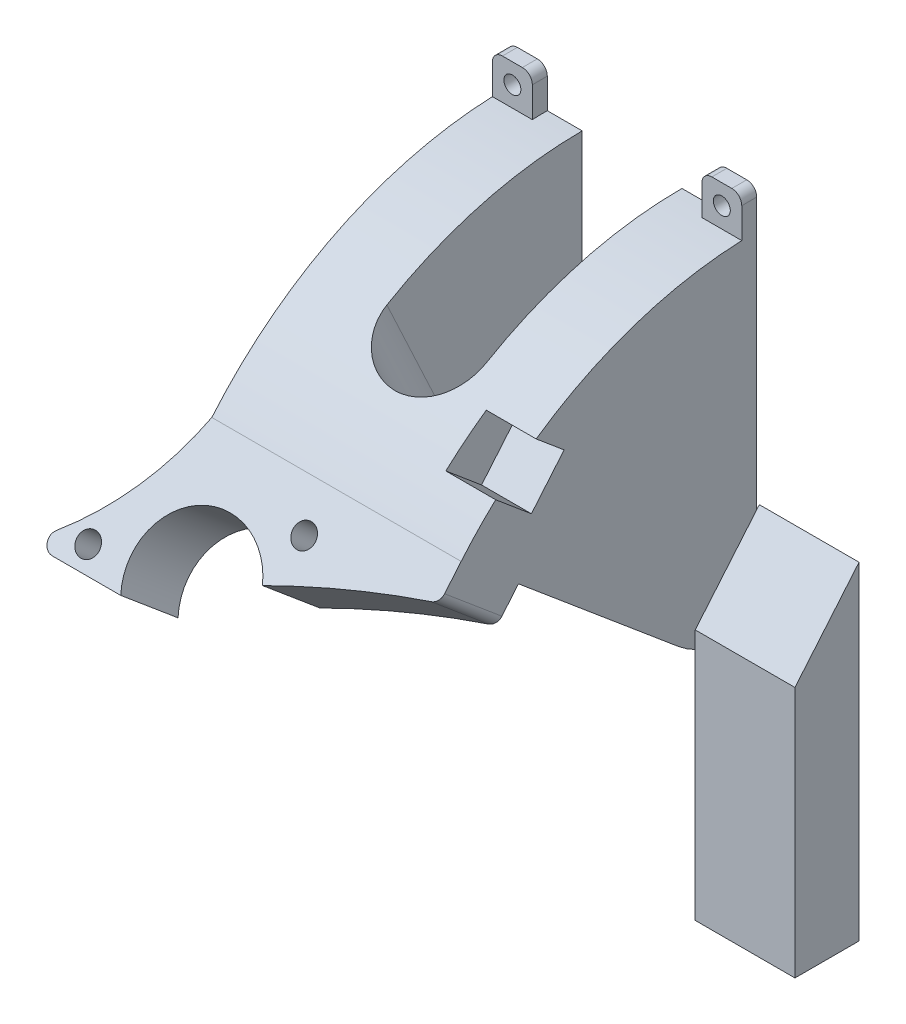
from build123d import *

# Parameters (mm, degrees)
AUFSATZ_LINEAR_AUSTRAGEN1_DEPTH    = 20
AUFSATZ_LINEAR_AUSTRAGEN2_DEPTH    = 20
AUFSATZ_LINEAR_AUSTRAGEN2_2_DEPTH  = 20
AUFSATZ_LINEAR_AUSTRAGEN3_DEPTH    = 50
AUFSATZ_LINEAR_AUSTRAGEN4_DEPTH    = 20
SCHNITT_LINEAR_AUSTRAGEN1_DEPTH    = 154.923378277
AUFSATZ_LINEAR_AUSTRAGEN5_DEPTH    = 50
VERRUNDUNG3_R                      = 2
SCHNITT_LINEAR_AUSTRAGEN3_DEPTH    = 5
SKIZZE12_W                         = 20
SKIZZE12_H                         = 50
SCHNITT_LINEAR_AUSTRAGEN4_DEPTH    = 163.425006425
VERRUNDUNG5_R                      = 10
VERRUNDUNG6_R                      = 10
SKIZZE13_R                         = 1.7
AUFSATZ_LINEAR_AUSTRAGEN9_DEPTH    = 3
VERRUNDUNG7_R                      = 2
VERRUNDUNG8_R                      = 2
SKIZZE14_W                         = 15
SKIZZE14_H                         = 9
SCHNITT_LINEAR_AUSTRAGEN5_DEPTH    = 156.193041065
VERRUNDUNG9_R                      = 18
SKIZZE15_R                         = 1.7
SCHNITT_LINEAR_AUSTRAGEN6_DEPTH    = 156.193041065
VERRUNDUNG10_R                     = 2
SKIZZE10_R                         = 2.25
SCHNITT_LINEAR_AUSTRAGEN2_DEPTH    = 152.160730356
SKIZZE18_W                         = 120
SKIZZE18_H                         = 10.2
SCHNITT_LINEAR_AUSTRAGEN8_DEPTH    = 10
VERRUNDUNG12_R                     = 18
VERRUNDUNG13_R                     = 2
SKIZZE16_R                         = 102.012355423
SCHNITT_LINEAR_AUSTRAGEN9_DEPTH    = 189.028945254
K_RPER_VERSCHIEBEN_KOPIEREN1_ANGLE = 90


with BuildPart() as part:
    # Skizze1 → Aufsatz-Linear austragen1 (new body)
    with BuildSketch(Plane(origin=(0, 0, 0), x_dir=(0, 0, -1), z_dir=(1, 0, 0))):
        Polygon((0, 0), (0, 65.780444431), (-12.855752194, 50.459555569), (-12.855752194, 0), align=None)
    extrude(amount=AUFSATZ_LINEAR_AUSTRAGEN1_DEPTH)


with BuildPart() as body_2:
    # Skizze2 → Aufsatz-Linear austragen2 (new body)
    with BuildSketch(Plane(origin=(0, 38.601549366, -32.390545836), x_dir=(-1, 0, 0), z_dir=(0, 0.7660444431189743, -0.6427876096865437))):
        with BuildLine():
            Line((90, 60.580920128), (90, 32.15785464))
            Line((90, 32.15785464), (40, 32.15785464))
            Line((40, 32.15785464), (40, 38.850263138))
            ThreePointArc((40, 38.850263138), (65.782949027, 47.91410669), (90, 60.580920128))
        make_face()
    extrude(amount=-AUFSATZ_LINEAR_AUSTRAGEN2_DEPTH)

    # Skizze4 → Aufsatz-Linear austragen3 (add)
    with BuildSketch(Plane.ZY.offset(90)):
        with BuildLine():
            ThreePointArc((-7.756199987, 59.272219883), (-28.145912406, 32.699829313), (-35.395290034, 0))
            Line((-35.395290034, 0), (41.979097856, 0))
            Line((41.979097856, 0), (5.099552207, 43.951331021))
            Line((5.099552207, 43.951331021), (-7.756199987, 59.272219883))
        make_face()
    extrude(amount=-AUFSATZ_LINEAR_AUSTRAGEN3_DEPTH)



with BuildPart() as body_3:
    # Skizze2 → Aufsatz-Linear austragen2 2 (new body)
    with BuildSketch(Plane(origin=(0, 38.601549366, -32.390545836), x_dir=(-1, 0, 0), z_dir=(0, 0.7660444431189743, -0.6427876096865437))):
        with BuildLine():
            Line((-110, 60.580920128), (-110, 32.15785464))
            Line((-110, 32.15785464), (-60, 32.15785464))
            Line((-60, 32.15785464), (-60, 38.850263138))
            ThreePointArc((-60, 38.850263138), (-85.782949027, 47.91410669), (-110, 60.580920128))
        make_face()
    extrude(amount=-AUFSATZ_LINEAR_AUSTRAGEN2_2_DEPTH)


with BuildPart() as body_2_1:
    add(body_2.part)

    add(body_3.part)  # Aufsatz-Linear austragen4 merges body 3
    # Skizze6 → Aufsatz-Linear austragen4 (add)
    with BuildSketch(Plane(origin=(0, 38.601549366, -32.390545836), x_dir=(1, 0, 0), z_dir=(0, 0.7660444431189745, -0.6427876096865438))):
        with BuildLine():
            ThreePointArc((-90, -32.15785464), (-97.308492273, -47.841026987), (-109.016228044, -60.580920128))
            Line((-109.016228044, -60.580920128), (-90, -60.580920128))
            Line((-90, -60.580920128), (-90, -32.15785464))
        make_face()
        with BuildLine():
            ThreePointArc((110, -32.15785464), (117.308492273, -47.841026987), (129.016228044, -60.580920128))
            Line((129.016228044, -60.580920128), (110, -60.580920128))
            Line((110, -60.580920128), (110, -32.15785464))
        make_face()
    extrude(amount=-AUFSATZ_LINEAR_AUSTRAGEN4_DEPTH)

    # Skizze5 → Schnitt-Linear austragen1 (cut, through all)
    with BuildSketch(Plane(origin=(0, 38.601549366, -32.390545836), x_dir=(1, 0, 0), z_dir=(0, 0.7660444431189745, -0.6427876096865438))):
        with BuildLine():
            ThreePointArc((-68.842783939, -49.276117645), (-85.255078401, -44.010631162), (-90, -60.580920128))
            ThreePointArc((-90, -60.580920128), (-79.599860388, -54.594510849), (-68.842783939, -49.276117645))
        make_face()
        with BuildLine():
            ThreePointArc((110, -60.580920128), (93.944642376, -65.178390536), (88.842783939, -49.276117645))
            ThreePointArc((88.842783939, -49.276117645), (105.255078401, -44.010631162), (110, -60.580920128))
        make_face()
    extrude(amount=-SCHNITT_LINEAR_AUSTRAGEN1_DEPTH, mode=Mode.SUBTRACT)

    # Skizze7 → Aufsatz-Linear austragen5 (add)
    with BuildSketch(Plane(origin=(60, 0, 0), x_dir=(0, 0, -1), z_dir=(1, 0, 0))):
        with BuildLine():
            Line((7.756199987, 59.272219883), (-41.979097856, 0))
            Line((-41.979097856, 0), (35.395290034, 0))
            ThreePointArc((35.395290034, 0), (28.145912406, 32.699829313), (7.756199987, 59.272219883))
        make_face()
    extrude(amount=AUFSATZ_LINEAR_AUSTRAGEN5_DEPTH)

    # Verrundung3
    verrundung3_edges = [body_2_1.edges().sort_by_distance(p)[0] for p in [
        (-109.016228044, 69.881769777, 20.445007484),
    ]]
    fillet(verrundung3_edges, radius=VERRUNDUNG3_R)

    # Skizze11 → Schnitt-Linear austragen3 (cut)
    with BuildSketch(Plane(origin=(0, 23.280660504, -19.534793642), x_dir=(1, 0, 0), z_dir=(0, -0.7660444431189745, 0.6427876096865438))):
        Polygon((60, 32.15785464), (110, 32.15785464), (141.028212288, 65.900023971), (38.343577108, 62.99282009), align=None)
        Polygon((-90, 32.15785464), (-40, 32.15785464), (-27.275304948, 44.003224364), (-71.113024931, 77.628353479), (-115.714952394, 75.544151261), (-104.04695397, 34.691764174), align=None)
    extrude(amount=-SCHNITT_LINEAR_AUSTRAGEN3_DEPTH, mode=Mode.SUBTRACT)

    # Skizze12 → Schnitt-Linear austragen4 (cut, through all)
    with BuildSketch(Plane(origin=(0, 16.620901993, -35.64363935), x_dir=(-1, 0, 0), z_dir=(0, 0.4226182617407026, -0.9063077870366486))):
        with Locations((65, 10.041304052)):
            Rectangle(SKIZZE12_W, SKIZZE12_H)
        with Locations((-85, 10.041304052)):
            Rectangle(SKIZZE12_W, SKIZZE12_H)
    extrude(amount=-SCHNITT_LINEAR_AUSTRAGEN4_DEPTH, mode=Mode.SUBTRACT)

    # Verrundung5
    verrundung5_edges = [body_2_1.edges().sort_by_distance(p)[0] for p in [
        (75, 39.454906174, -1.696530215),
        (95, 39.454906174, -1.696530215),
    ]]
    fillet(verrundung5_edges, radius=VERRUNDUNG5_R - 0.0001)  # a hair under: the kernel refuses the full size

    # Verrundung6
    verrundung6_edges = [body_2_1.edges().sort_by_distance(p)[0] for p in [
        (-55, 39.454906174, -1.696530215),
        (-75, 39.454906174, -1.696530215),
    ]]
    fillet(verrundung6_edges, radius=VERRUNDUNG6_R - 0.0001)  # a hair under: the kernel refuses the full size

    # Skizze13 → Aufsatz-Linear austragen9 (add)
    # profile 1 of 4: a face of its own
    with BuildSketch(Plane(origin=(0, 0, 0), x_dir=(1, 0, 0), z_dir=(0, 1, 0))):
        Polygon((-40, 35.395290034), (-40, 43.395290034), (-48, 43.395290034), (-48, 35.395290034), (-48, 33.395851283), (-40, 33.395851283), align=None)
        with Locations(Location((-44, 39.395290034, 0), (0, 0, 270))):
            Circle(SKIZZE13_R, mode=Mode.SUBTRACT)
    # profile 2 of 4: a face of its own
    with BuildSketch(Plane(origin=(0, 0, 0), x_dir=(1, 0, 0), z_dir=(0, 1, 0))):
        Polygon((-90, 43.395290034), (-82, 43.395290034), (-82, 35.395290034), (-82, 33.395851283), (-90, 33.395851283), (-90, 35.395290034), align=None)
        with Locations(Location((-86, 39.395290034, 0), (0, 0, 90))):
            Circle(SKIZZE13_R, mode=Mode.SUBTRACT)
    # profile 3 of 4: a face of its own
    with BuildSketch(Plane(origin=(0, 0, 0), x_dir=(1, 0, 0), z_dir=(0, 1, 0))):
        Polygon((68, 33.395851283), (68, 35.395290034), (68, 43.395290034), (60, 43.395290034), (60, 35.395290034), (60, 33.395851283), align=None)
        with Locations(Location((64, 39.395290034, 0), (0, 0, 90))):
            Circle(SKIZZE13_R, mode=Mode.SUBTRACT)
    # profile 4 of 4: a face of its own
    with BuildSketch(Plane(origin=(0, 0, 0), x_dir=(1, 0, 0), z_dir=(0, 1, 0))):
        Polygon((110, 33.395851283), (102, 33.395851283), (102, 35.395290034), (102, 43.395290034), (110, 43.395290034), (110, 35.395290034), align=None)
        with Locations(Location((106, 39.395290034, 0), (0, 0, 270))):
            Circle(SKIZZE13_R, mode=Mode.SUBTRACT)
    extrude(amount=AUFSATZ_LINEAR_AUSTRAGEN9_DEPTH)

    # Verrundung7
    verrundung7_edges = [body_2_1.edges().sort_by_distance(p)[0] for p in [
        (-40, 1.5, -43.395290034),
        (-48, 1.5, -43.395290034),
        (-90, 1.5, -43.395290034),
        (-82, 1.5, -43.395290034),
    ]]
    fillet(verrundung7_edges, radius=VERRUNDUNG7_R)

    # Verrundung8
    verrundung8_edges = [body_2_1.edges().sort_by_distance(p)[0] for p in [
        (60, 1.5, -43.395290034),
        (68, 1.5, -43.395290034),
        (102, 1.5, -43.395290034),
        (110, 1.5, -43.395290034),
    ]]
    fillet(verrundung8_edges, radius=VERRUNDUNG8_R)

    # Skizze14 → Schnitt-Linear austragen5 (cut, through all)
    with BuildSketch(Plane(origin=(0, 3, 0), x_dir=(-1, 0, 0), z_dir=(0, -1, 0))):
        with Locations((82.5, -37.479097856)):
            Rectangle(SKIZZE14_W, SKIZZE14_H)
        with Locations((47.5, -37.479097856)):
            Rectangle(SKIZZE14_W, SKIZZE14_H)
        with Locations((-67.5, -37.479097856)):
            Rectangle(SKIZZE14_W, SKIZZE14_H)
        with Locations((-102.5, -37.479097856)):
            Rectangle(SKIZZE14_W, SKIZZE14_H)
    extrude(amount=-SCHNITT_LINEAR_AUSTRAGEN5_DEPTH, mode=Mode.SUBTRACT)

    # Verrundung9
    verrundung9_edges = [body_2_1.edges().sort_by_distance(p)[0] for p in [
        (-47.5, 10.725782333, 32.979097856),
        (-82.5, 10.725782333, 32.979097856),
    ]]
    fillet(verrundung9_edges, radius=VERRUNDUNG9_R)

    # Skizze15 → Schnitt-Linear austragen6 (cut, through all)
    with BuildSketch(Plane(origin=(0, 3, 0), x_dir=(-1, 0, 0), z_dir=(0, -1, 0))):
        with Locations(Location((82.5, -36.22044841, 0), (0, 0, 180))):
            Circle(SKIZZE15_R)
        with Locations((47.5, -36.22044841)):
            Circle(SKIZZE15_R)
        with Locations((-102.5, -36.22044841)):
            Circle(SKIZZE15_R)
        with Locations(Location((-67.5, -36.22044841, 0), (0, 0, 180))):
            Circle(SKIZZE15_R)
    extrude(amount=SCHNITT_LINEAR_AUSTRAGEN6_DEPTH, mode=Mode.SUBTRACT)

    # Verrundung10
    verrundung10_edges = [body_2_1.edges().sort_by_distance(p)[0] for p in [
        (129.016228044, 71.796880885, 18.838038459),
        (60, 57.828683821, 2.191389427),
    ]]
    fillet(verrundung10_edges, radius=VERRUNDUNG10_R)

    # Skizze10 → Schnitt-Linear austragen2 (cut, through all)
    with BuildSketch(Plane(origin=(0, 38.601549366, -32.390545836), x_dir=(1, 0, 0), z_dir=(0, 0.7660444431189745, -0.6427876096865438))):
        with Locations(Location((119.098941858, -56.580920128, 0), (0, 0, 270))):
            Circle(SKIZZE10_R)
        with Locations(Location((86.348024598, -40.153290395, 0), (0, 0, 270))):
            Circle(SKIZZE10_R)
        with Locations(Location((-66.348024598, -40.153290395, 0), (0, 0, 270))):
            Circle(SKIZZE10_R)
        with Locations(Location((-99.098941858, -56.580920128, 0), (0, 0, 270))):
            Circle(SKIZZE10_R)
    extrude(amount=-SCHNITT_LINEAR_AUSTRAGEN2_DEPTH, mode=Mode.SUBTRACT)

    # Skizze18 → Schnitt-Linear austragen8 (cut)
    with BuildSketch(Plane(origin=(0, 38.601549366, -32.390545836), x_dir=(1, 0, 0), z_dir=(0, 0.7660444431189745, -0.6427876096865438))):
        with Locations((10, -17.05785464)):
            Rectangle(SKIZZE18_W, SKIZZE18_H)
    extrude(amount=-SCHNITT_LINEAR_AUSTRAGEN8_DEPTH, mode=Mode.SUBTRACT)

    # Verrundung12
    verrundung12_edges = [body_2_1.edges().sort_by_distance(p)[0] for p in [
        (102.5, 10.725782333, 32.979097856),
        (67.5, 10.725782333, 32.979097856),
    ]]
    fillet(verrundung12_edges, radius=VERRUNDUNG12_R)

    # Verrundung13
    verrundung13_edges = [body_2_1.edges().sort_by_distance(p)[0] for p in [
        (-40, 57.828683821, 2.191389427),
    ]]
    fillet(verrundung13_edges, radius=VERRUNDUNG13_R)

    # Skizze16 → Schnitt-Linear austragen9 (cut, through all)
    with BuildSketch(Plane(origin=(60, 0, 0), x_dir=(0, 0, -1), z_dir=(1, 0, 0))):
        with Locations((7.48825997, 22.250503314)):
            Circle(SKIZZE16_R)
    extrude(amount=SCHNITT_LINEAR_AUSTRAGEN9_DEPTH, mode=Mode.SUBTRACT)


with BuildPart() as body_2_2:
    # Körper-Verschieben/Kopieren1: moved
    add(body_2_1.part.rotate(Axis((0, 38.771107104, -0.708096089), (1, 0, 0)), K_RPER_VERSCHIEBEN_KOPIEREN1_ANGLE))


solid = Compound([part.part, body_2_2.part])
